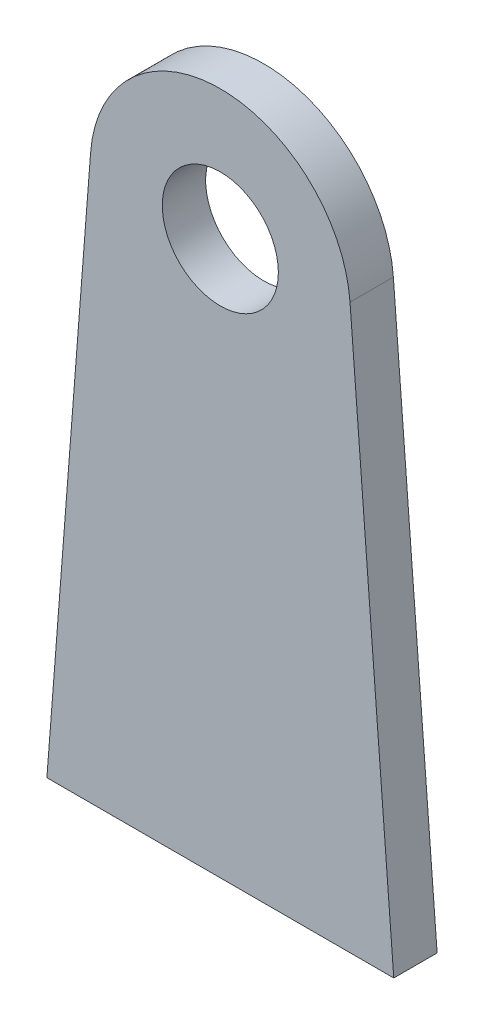
from build123d import *

# Parameters (mm, degrees)
SKETCH2_R           = 4.25
BOSS_EXTRUDE2_DEPTH = 3.175


with BuildPart() as part:
    # Sketch2 → Boss-Extrude2 (new body)
    with BuildSketch(Plane.XY):
        with BuildLine():
            ThreePointArc((10.649817288, 1.046599209), (1.1534075, 9.83415352), (-8.343002287, 1.046599209))
            Line((-8.343002287, 1.046599209), (-11.5465925, -40.207429246))
            Line((-11.5465925, -40.207429246), (13.8534075, -40.207429246))
            Line((13.8534075, -40.207429246), (10.649817288, 1.046599209))
        make_face()
        with Locations((1.1534075, 0.30915352)):
            Circle(SKETCH2_R, mode=Mode.SUBTRACT)
    extrude(amount=BOSS_EXTRUDE2_DEPTH)


solid = part.part
